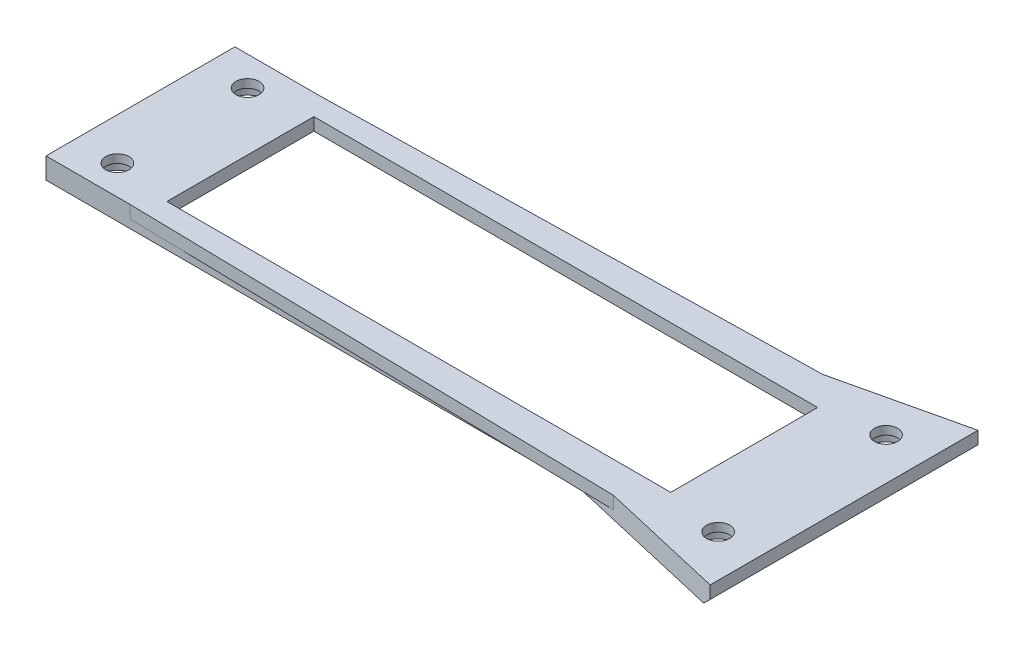
from build123d import *

# Parameters (mm, degrees)
BOSS_EXTRUDE1_DEPTH     = 5
CUT_EXTRUDE1_DEPTH      = 92.215662378
CUT_EXTRUDE1_DEPTH_BACK = 92.215662378
SKETCH2_R               = 2.75
CUT_EXTRUDE2_DEPTH      = 92.215662378
CUT_EXTRUDE2_DEPTH_BACK = 92.215662378
CHAMFER3_SIZE           = 2
CUT_EXTRUDE3_DEPTH      = 90.804241831
CUT_EXTRUDE3_DEPTH_BACK = 90.804241831
SKETCH4_W               = 120
SKETCH4_H               = 35
CHAMFER4_SIZE           = 2
SKETCH5_R               = 5
CUT_EXTRUDE4_DEPTH      = 3


with BuildPart() as part:
    # Sketch1 → Boss-Extrude1 (new body)
    with BuildSketch(Plane(origin=(0, 0, 0), x_dir=(1, 0, 0), z_dir=(0, 1, 0))):
        Polygon((-73.8, 35.677122405), (-83.8, 35.677122405), (-83.8, -35.677122405), (-73.8, -35.677122405), (73.8, -35.677122405), (83.8, -35.677122405), (83.8, 35.677122405), (73.8, 35.677122405), align=None)
    extrude(amount=BOSS_EXTRUDE1_DEPTH)

    # Sketch2 → Cut-Extrude1 (cut, two sides: drawn at the far end of the back side and taken through both)
    with BuildSketch(Plane(origin=(0, 5, 0), x_dir=(1, 0, 0), z_dir=(0, 1, 0)).offset(-CUT_EXTRUDE1_DEPTH_BACK)):
        with Locations(Location((-73.8, -15.5, 0), (0, 0, 270))):
            Circle(SKETCH2_R)
        with Locations(Location((-73.8, 15.5, 0), (0, 0, 270))):
            Circle(SKETCH2_R)
        with Locations(Location((73.797239672, -20, 0), (0, 0, 270))):
            Circle(SKETCH2_R)
        with Locations(Location((73.797239672, 20, 0), (0, 0, 270))):
            Circle(SKETCH2_R)
    extrude(amount=CUT_EXTRUDE1_DEPTH + CUT_EXTRUDE1_DEPTH_BACK, mode=Mode.SUBTRACT)

    # Sketch3 → Cut-Extrude2 (cut, two sides: drawn at the far end of the back side and taken through both)
    with BuildSketch(Plane(origin=(0, 5, 0), x_dir=(1, 0, 0), z_dir=(0, 1, 0)).offset(-CUT_EXTRUDE2_DEPTH_BACK)):
        Polygon((-63.8, -22.5), (53.754373535, -24.93027399), (90.089947098, -33.354383806), (45.106765394, -114.519737278), (-93.808894925, -48.481732373), (-93.808894925, -22.5), align=None)
        Polygon((53.754373535, 24.93027399), (-63.8, 22.5), (-93.808894925, 22.5), (-93.808894925, 75.103676807), (90.089947098, 109.537779365), (90.089947098, 33.354383806), align=None)
    extrude(amount=CUT_EXTRUDE2_DEPTH + CUT_EXTRUDE2_DEPTH_BACK, mode=Mode.SUBTRACT)

    # Chamfer3
    # the kernel refuses this chamfer: 2 mm, written as the material it takes off along each edge
    with BuildSketch(Plane(origin=(83.8, 0, 37.039476252), x_dir=(-0.9996219169112968, -0.027495876610586292, 0), z_dir=(0, 0, -1))) as chamfer3_piece_1:
        Polygon((CHAMFER3_SIZE * 0.999621916911, CHAMFER3_SIZE * 0.0274958766106), (-CHAMFER3_SIZE * 0.0274958766106, CHAMFER3_SIZE * 0.999621916911), (0, 0), align=None)
    extrude(amount=74.078952505, mode=Mode.SUBTRACT)
    with BuildSketch(Plane(origin=(58.89664073, 0, 25.036583248), x_dir=(0.020661384909083567, -0.027495876610586414, -0.9994083669566981), z_dir=(-0.9997863692752371, 0, -0.020669199583903272))) as chamfer3_piece_2_section:
        Polygon((CHAMFER3_SIZE * 0.999621916911, -CHAMFER3_SIZE * 0.0274958766106), (-CHAMFER3_SIZE * 0.0274958766106, -CHAMFER3_SIZE * 0.999621916911), (0, 0), align=None)
    chamfer3_piece_2 = extrude(amount=127.866224079, mode=Mode.PRIVATE)
    chamfer3_piece_2 = split(chamfer3_piece_2, bisect_by=Plane(origin=(6.389506061, 0.738517017, 22.5), z_dir=(0, 0, 1)), keep=Keep.TOP, mode=Mode.PRIVATE)
    chamfer3_piece_2 = split(chamfer3_piece_2, bisect_by=Plane(origin=(8.475011093, 0.738517017, 14.432618822), z_dir=(-0.22585154444898248, 0, 0.9741617318854243)), keep=Keep.TOP, mode=Mode.PRIVATE)
    add(chamfer3_piece_2, mode=Mode.SUBTRACT)
    with BuildSketch(Plane(origin=(-68.942267195, 0, -22.393690742), x_dir=(0.020661384909228912, -0.027495876610586358, 0.9994083669566951), z_dir=(0.9997863692752341, 0, -0.02066919958404867))) as chamfer3_piece_3_section:
        Polygon((CHAMFER3_SIZE * 0.999621916911, -CHAMFER3_SIZE * 0.0274958766106), (-CHAMFER3_SIZE * 0.0274958766106, -CHAMFER3_SIZE * 0.999621916911), (0, 0), align=None)
    chamfer3_piece_3 = extrude(amount=127.866224079, mode=Mode.PRIVATE)
    chamfer3_piece_3 = split(chamfer3_piece_3, bisect_by=Plane(origin=(6.389506061, 0.738517017, -22.5), z_dir=(0, 0, -1)), keep=Keep.TOP, mode=Mode.PRIVATE)
    chamfer3_piece_3 = split(chamfer3_piece_3, bisect_by=Plane(origin=(8.475011093, 0.738517017, -14.432618822), z_dir=(-0.22585154444898248, 0, -0.9741617318854243)), keep=Keep.TOP, mode=Mode.PRIVATE)
    add(chamfer3_piece_3, mode=Mode.SUBTRACT)

    # Sketch4 → Cut-Extrude3 (cut, two sides: drawn at the far end of the back side and taken through both)
    with BuildSketch(Plane.XZ.offset(-CUT_EXTRUDE3_DEPTH_BACK)):
        Rectangle(SKETCH4_W, SKETCH4_H)
    extrude(amount=CUT_EXTRUDE3_DEPTH + CUT_EXTRUDE3_DEPTH_BACK, mode=Mode.SUBTRACT)

    # Chamfer4
    chamfer4_edges = [part.edges().sort_by_distance(p)[0] for p in [
        (0, 0, -17.5),
        (60, 0, 0),
        (0, 0, 17.5),
        (-60, 0, 0),
    ]]
    chamfer(chamfer4_edges, length=CHAMFER4_SIZE)

    # Sketch5 → Cut-Extrude4 (cut)
    with BuildSketch(Plane.XZ):
        with Locations(Location((-73.8, 15.5, 0), (0, 0, 270))):
            Circle(SKETCH5_R)
        with Locations(Location((-73.8, -15.5, 0), (0, 0, 270))):
            Circle(SKETCH5_R)
        with Locations(Location((73.797239672, 20, 0), (0, 0, 270))):
            Circle(SKETCH5_R)
        with Locations(Location((73.797239672, -20, 0), (0, 0, 270))):
            Circle(SKETCH5_R)
    extrude(amount=-CUT_EXTRUDE4_DEPTH, mode=Mode.SUBTRACT)


solid = part.part
